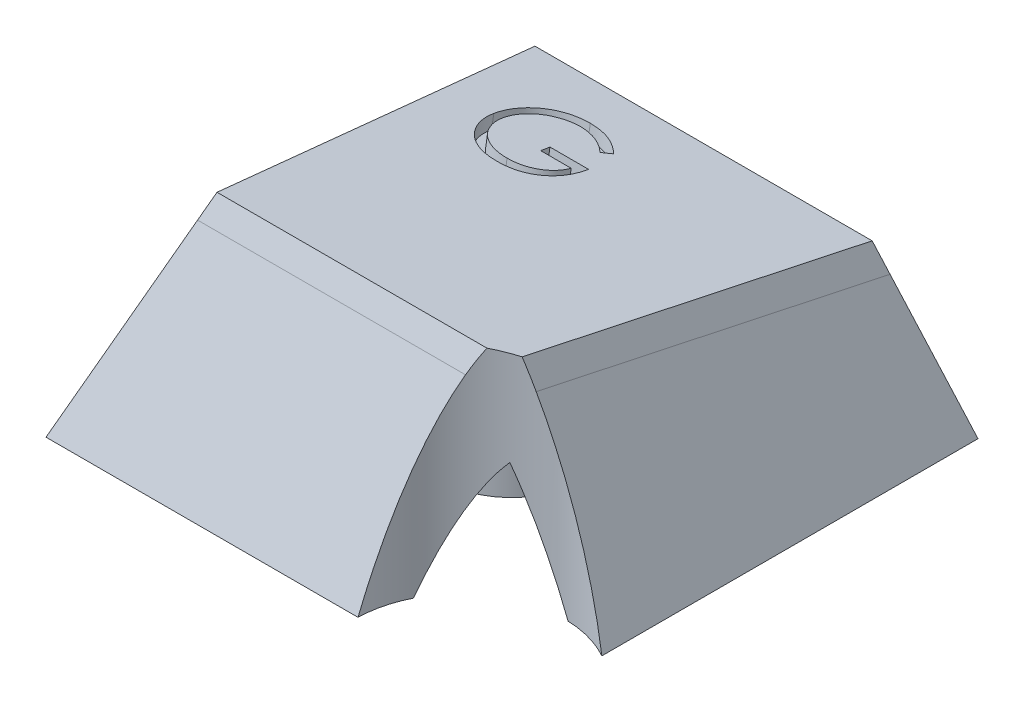
from build123d import *

# Parameters (mm, degrees)
OTHER_START         = 7.189240539
OTHER_2_OUTLINE_W   = 16
OTHER_2_OUTLINE_H   = 16
OTHER_2_DEPTH       = 1.9877561
SKETCH_20_R         = 2.8
EXTRUDE_2_DEPTH     = 6.5
SKETCH_22_R         = 4
CUT_EXTRUDE_2_DEPTH = 9
CUT_EXTRUDE_3_DEPTH = 0.5


# Read off the part's stored shape, not the designer's step: 相交2
with BuildPart() as part:
    # 草图4 → Loft 1 section 0
    with BuildSketch(Plane(origin=(0, 8.2, 0), x_dir=(1, 0, 0), z_dir=(0, 1, 0))):
        with BuildLine():
            Line((-5.6, 6.8), (5.6, 6.8))
            Line((5.6, 6.8), (5.6, -5.7))
            Line((5.6, -5.7), (-5.6, -5.7))
            Line((-5.6, -5.7), (-5.6, 6.8))
        make_face()
    # 草图1 → Loft 1 section 1
    with BuildSketch(Plane(origin=(0, 0, 0), x_dir=(1, 0, 0), z_dir=(0, 1, 0))):
        with BuildLine():
            Line((-8.95, -8.9), (8.95, -8.9))
            Line((8.95, -8.9), (8.95, 8.9))
            Line((8.95, 8.9), (-8.95, 8.9))
            Line((-8.95, 8.9), (-8.95, -8.9))
        make_face()
    loft()

    # 相交2 outline → 相交2 (cut)
    with BuildSketch(Plane(origin=(0, 0, 0), x_dir=(1, 0, 0), z_dir=(0, 0.9872752829851917, -0.15902048800865198)).offset(OTHER_START)):
        Rectangle(OTHER_2_OUTLINE_W, OTHER_2_OUTLINE_H)
    extrude(amount=OTHER_2_DEPTH, mode=Mode.SUBTRACT)

    # 草图19 → Loft 1 2 section 0
    with BuildSketch(Plane(origin=(0, 6.132664073, -0.987788564), x_dir=(1, 0, 0), z_dir=(0, 0.9872752829851916, -0.15902048800865207))):
        with BuildLine():
            Line((-4.985089723, 5.299749211), (4.985089723, 5.299749211))
            Line((4.985089723, 5.299749211), (4.287230721, -5.442213697))
            Line((4.287230721, -5.442213697), (-4.287230721, -5.442213697))
            Line((-4.287230721, -5.442213697), (-4.985089723, 5.299749211))
        make_face()
    # 草图8 → Loft 1 2 section 1
    with BuildSketch(Plane.XZ):
        with BuildLine():
            Line((-7.15, 7.2), (7.15, 7.2))
            Line((7.15, 7.2), (7.15, -7.5))
            Line((7.15, -7.5), (-7.15, -7.5))
            Line((-7.15, -7.5), (-7.15, 7.2))
        make_face()
    loft(mode=Mode.SUBTRACT)

    # 草图20 → 凸台-拉伸2 (add)
    with BuildSketch(Plane.XZ):
        with Locations(Location((0, 0, 0), (0, 0, 270))):
            Circle(SKETCH_20_R)
        Polygon((-2.2, 0.8), (-0.8, 0.8), (-0.8, 2.2), (0.8, 2.2), (0.8, 0.8), (2.2, 0.8), (2.2, -0.8), (0.8, -0.8), (0.8, -2.2), (-0.8, -2.2), (-0.8, -0.8), (-2.2, -0.8), align=None, mode=Mode.SUBTRACT)
    extrude(amount=-EXTRUDE_2_DEPTH)

    # 草图22 → 切除-拉伸2 (cut)
    with BuildSketch(Plane.XZ):
        with Locations((7, 9)):
            Circle(SKETCH_22_R)
    extrude(amount=-CUT_EXTRUDE_2_DEPTH, mode=Mode.SUBTRACT)

    # 草图23 → 切除-拉伸3 (cut)
    with BuildSketch(Plane(origin=(0, 7.097759487, -1.143236539), x_dir=(1, 0, 0), z_dir=(0, 0.9872752829851916, -0.15902048800865207))):
        with BuildLine():
            Line((-0.979801877, 3.777052641), (-1.249032646, 3.521844308))
            add(Edge.make_bspline(
                [(-1.249032646, 3.521844308), (-1.297751534, 3.567675171), (-1.39402758, 3.658244034), (-1.550987823, 3.775755029), (-1.714751457, 3.876421129), (-1.884463954, 3.958327366), (-2.055922508, 4.023680126), (-2.226851284, 4.070208266), (-2.395496985, 4.099880804), (-2.507664204, 4.103429173), (-2.562934889, 4.105177641)],
                knots=[0, 0, 0, 0, 1.08915593, 2.152340314, 3.188132944, 4.216796309, 5.218260357, 6.173443236, 7.099959455, 8, 8, 8, 8], degree=3))
            add(Edge.make_bspline(
                [(-2.562934889, 4.105177641), (-2.596849589, 4.104764035), (-2.66459103, 4.103937896), (-2.765212974, 4.093393681), (-2.864779611, 4.078228817), (-2.963102986, 4.056286939), (-3.060374272, 4.02847788), (-3.156255164, 3.993692417), (-3.250924519, 3.953137172), (-3.3434906, 3.906274699), (-3.433231104, 3.854794852), (-3.517987939, 3.797746312), (-3.598301338, 3.736957522), (-3.672661763, 3.670906542), (-3.74149695, 3.600191677), (-3.806445322, 3.526128371), (-3.865222618, 3.446693152), (-3.918313783, 3.363347526), (-3.965675401, 3.277555337), (-4.007484055, 3.190142347), (-4.042581143, 3.101398493), (-4.070350598, 3.011212415), (-4.093261252, 2.920281825), (-4.109378859, 2.827977105), (-4.118465582, 2.73419942), (-4.120037361, 2.671402161), (-4.120827518, 2.63983309)],
                knots=[0, 0, 0, 0, 1.02818874, 2.053710826, 3.065248034, 4.081641283, 5.106893873, 6.131558223, 7.173050175, 8.228653731, 9.27666206, 10.308777013, 11.325269123, 12.329503258, 13.32196095, 14.316845687, 15.314881793, 16.315733098, 17.311955233, 18.285320748, 19.252783886, 20.203351036, 21.145449891, 22.095197417, 23.042428769, 24, 24, 24, 24], degree=3))
            add(Edge.make_bspline(
                [(-4.120827518, 2.63983309), (-4.120071799, 2.607562273), (-4.118562426, 2.543108759), (-4.108902107, 2.446914687), (-4.090973866, 2.352149284), (-4.067006157, 2.258501151), (-4.037025342, 2.165809903), (-3.999652676, 2.074477393), (-3.955387075, 1.984507002), (-3.904150523, 1.896709385), (-3.84796432, 1.811186362), (-3.785021239, 1.73062684), (-3.718160655, 1.653958063), (-3.644946755, 1.582882299), (-3.567727213, 1.515498403), (-3.484194937, 1.453662881), (-3.395992477, 1.396184658), (-3.302985265, 1.343788138), (-3.206182482, 1.296979603), (-3.106925729, 1.255355706), (-3.004897914, 1.221076369), (-2.900635224, 1.193138265), (-2.794261952, 1.170237968), (-2.68523815, 1.155505488), (-2.574365441, 1.144814657), (-2.499626809, 1.144032987), (-2.461973351, 1.14363918)],
                knots=[0, 0, 0, 0, 0.93586088, 1.869166235, 2.799637598, 3.729985548, 4.670839027, 5.622275134, 6.589130586, 7.576015415, 8.568469353, 9.55398029, 10.53834874, 11.515998671, 12.510579167, 13.508179873, 14.527009472, 15.561807829, 16.601455013, 17.643573243, 18.680854198, 19.719860599, 20.772568776, 21.833555941, 22.908541556, 24, 24, 24, 24], degree=3))
            add(Edge.make_bspline(
                [(-2.461973351, 1.14363918), (-2.416595004, 1.144587756), (-2.327487246, 1.14645044), (-2.196500804, 1.160950729), (-2.070697733, 1.183597523), (-1.95043153, 1.21676342), (-1.835562509, 1.259067095), (-1.725669568, 1.310062481), (-1.621617909, 1.37170554), (-1.523094735, 1.441279407), (-1.43233755, 1.51879424), (-1.350483426, 1.602438695), (-1.278837937, 1.691806762), (-1.216333237, 1.786372077), (-1.164624583, 1.886917382), (-1.122181788, 1.992949944), (-1.089648496, 2.104517456), (-1.076293522, 2.181609088), (-1.069545466, 2.220562257)],
                knots=[0, 0, 0, 0, 1.13008108, 2.219097802, 3.278683437, 4.311054135, 5.322181354, 6.324827112, 7.324222904, 8.330512327, 9.32562643, 10.293043162, 11.24128371, 12.174520618, 13.111833804, 14.052305215, 15.015860969, 16, 16, 16, 16], degree=3))
            Line((-1.069545466, 2.220562257), (-2.236212133, 2.220562257))
            Line((-2.236212133, 2.220562257), (-2.236212133, 2.579536616))
            Line((-2.236212133, 2.579536616), (-0.755442902, 2.579536616))
            add(Edge.make_bspline(
                [(-0.755442902, 2.579536616), (-0.757148751, 2.512629127), (-0.760487404, 2.381679085), (-0.78390632, 2.190708814), (-0.821722832, 2.010337121), (-0.873383144, 1.840374049), (-0.940258424, 1.681060457), (-1.021630952, 1.53223459), (-1.118803074, 1.39485791), (-1.228313515, 1.267808906), (-1.351213473, 1.154479694), (-1.484182093, 1.054873756), (-1.627439061, 0.970971141), (-1.780848869, 0.902710478), (-1.943909302, 0.849436483), (-2.116997682, 0.811664907), (-2.299879283, 0.789034943), (-2.425215959, 0.786143564), (-2.489317101, 0.784664821)],
                knots=[0, 0, 0, 0, 1.140356446, 2.231883559, 3.274166699, 4.278491846, 5.25512956, 6.21435461, 7.1637429, 8.11826594, 9.068280886, 10.0076534, 10.945064095, 11.891975133, 12.864533718, 13.863980011, 14.907571808, 16, 16, 16, 16], degree=3))
            add(Edge.make_bspline(
                [(-2.489317101, 0.784664821), (-2.528827236, 0.785233942), (-2.606753957, 0.786356433), (-2.721844885, 0.79433378), (-2.833762506, 0.806614356), (-2.942490515, 0.82515948), (-3.048428857, 0.847874134), (-3.151048442, 0.876960853), (-3.250740184, 0.910629552), (-3.347658169, 0.948925226), (-3.440922716, 0.993296882), (-3.530949233, 1.042606522), (-3.618235359, 1.096599882), (-3.702186524, 1.156210728), (-3.783240145, 1.220993188), (-3.860873589, 1.291077107), (-3.935521467, 1.366248227), (-3.982281931, 1.419627237), (-4.005843543, 1.446523795)],
                knots=[0, 0, 0, 0, 1.107784379, 2.184907829, 3.233506516, 4.263428166, 5.276301166, 6.270063455, 7.25232949, 8.225834625, 9.190232166, 10.146266622, 11.1027726, 12.066435141, 13.031522626, 14.010570082, 14.99756817, 16, 16, 16, 16], degree=3))
            add(Edge.make_bspline(
                [(-4.005843543, 1.446523795), (-4.040029475, 1.489194448), (-4.107833888, 1.573827465), (-4.195112044, 1.70942741), (-4.269513447, 1.84982927), (-4.329881269, 1.995423898), (-4.377019356, 2.146075111), (-4.410825608, 2.301590402), (-4.430632898, 2.462170033), (-4.433486435, 2.570835298), (-4.434930082, 2.625810654)],
                knots=[0, 0, 0, 0, 1.023165419, 2.029347347, 3.013907458, 3.994755782, 4.975994455, 5.96558838, 6.970761222, 8, 8, 8, 8], degree=3))
            add(Edge.make_bspline(
                [(-4.434930082, 2.625810654), (-4.434397844, 2.666976907), (-4.433340132, 2.748786214), (-4.420514615, 2.870243522), (-4.402113197, 2.989544214), (-4.375066143, 3.10659077), (-4.340969878, 3.221461362), (-4.298416392, 3.334209326), (-4.248871496, 3.444901197), (-4.191286, 3.552775065), (-4.127201541, 3.656399478), (-4.05765132, 3.755357282), (-3.98164772, 3.847846347), (-3.90043192, 3.935037995), (-3.81303493, 4.015836842), (-3.720275507, 4.090990953), (-3.622082164, 4.160601138), (-3.518145984, 4.223570973), (-3.410018299, 4.280134594), (-3.297958298, 4.329723805), (-3.182000187, 4.370707121), (-3.063012709, 4.4054809), (-2.940095209, 4.431196041), (-2.814139672, 4.449844786), (-2.68448956, 4.462605386), (-2.59685353, 4.463631642), (-2.552418062, 4.464152)],
                knots=[0, 0, 0, 0, 1.008945113, 2.00506715, 2.99143336, 3.967273523, 4.948097931, 5.927297278, 6.919902385, 7.919676788, 8.923139349, 9.905703106, 10.883022732, 11.856032218, 12.825136022, 13.798837087, 14.781400844, 15.773989409, 16.776158564, 17.77167057, 18.775803737, 19.789618931, 20.80898985, 21.851988756, 22.910860228, 24, 24, 24, 24], degree=3))
            add(Edge.make_bspline(
                [(-2.552418062, 4.464152), (-2.516179819, 4.463572509), (-2.44432364, 4.462423445), (-2.337397908, 4.454458797), (-2.232124893, 4.441834915), (-2.128348503, 4.424608129), (-2.026422137, 4.401144438), (-1.926055432, 4.373066154), (-1.827102895, 4.340374331), (-1.729874646, 4.301385485), (-1.63371693, 4.25713186), (-1.53809509, 4.207318437), (-1.443335844, 4.151093433), (-1.349274862, 4.088289897), (-1.255319004, 4.019986479), (-1.162954362, 3.944229656), (-1.069951418, 3.8640069), (-1.010149603, 3.806324716), (-0.979801877, 3.777052641)],
                knots=[0, 0, 0, 0, 0.985871117, 1.954866573, 2.915460327, 3.869826059, 4.81536089, 5.759505086, 6.70452669, 7.649098992, 8.607881297, 9.583363685, 10.581137262, 11.603961102, 12.659522466, 13.73993555, 14.853081303, 16, 16, 16, 16], degree=3))
        make_face()
    extrude(amount=-CUT_EXTRUDE_3_DEPTH, mode=Mode.SUBTRACT)


solid = part.part
